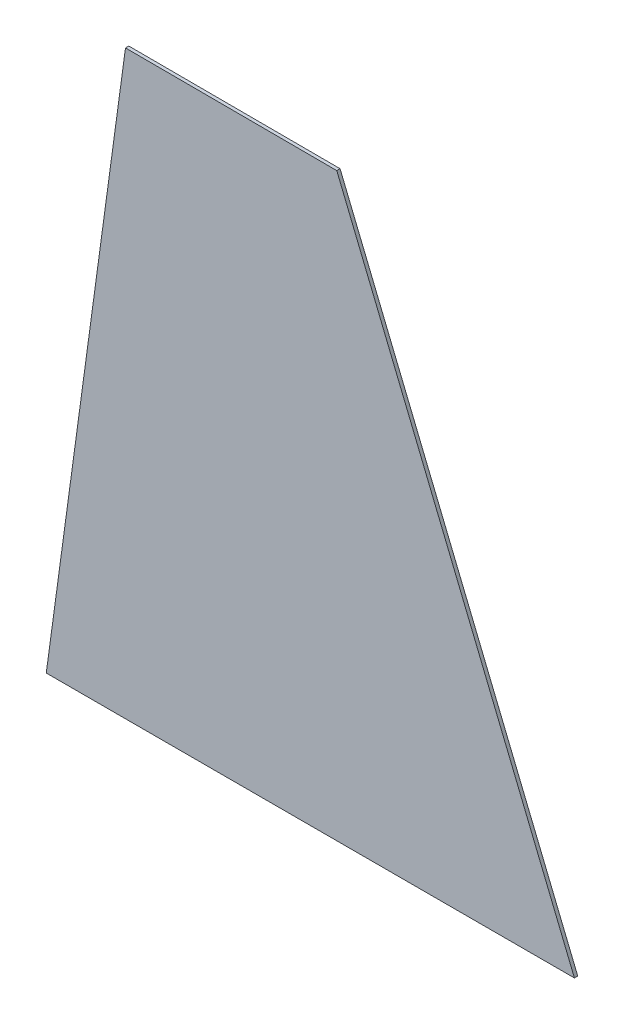
from build123d import *

# Parameters (mm, degrees)
BOSS_EXTRUDE1_DEPTH = 3.175


with BuildPart() as part:
    # Sketch1 → Boss-Extrude1 (new body)
    with BuildSketch(Plane.XY):
        Polygon((-76.2, 0), (0, 0), (177.8, 0), (431.799179267, 0), (203.199179267, 558.22246613), (0, 558.8), align=None)
    extrude(amount=BOSS_EXTRUDE1_DEPTH)


solid = part.part
